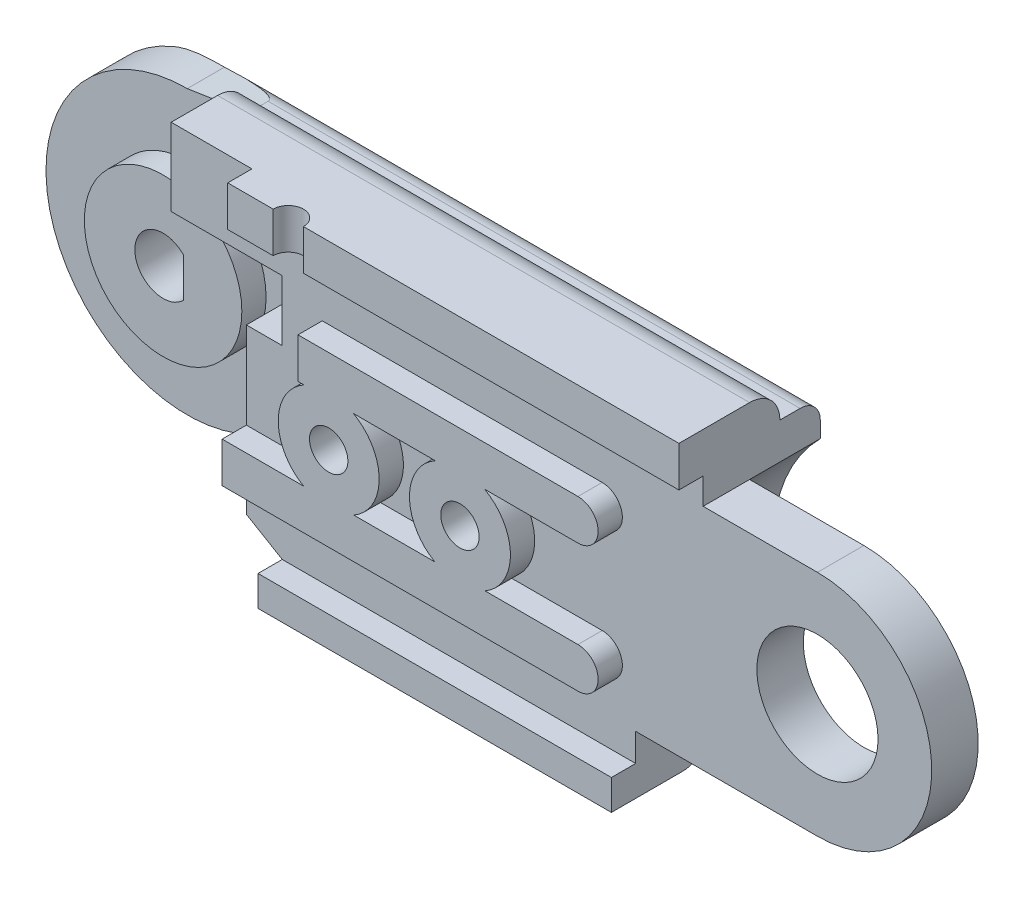
from build123d import *

# Parameters (mm, degrees)
BOSS_EXTRUDE1_DEPTH = 2
BOSS_EXTRUDE2_DEPTH = 1.5
BOSS_EXTRUDE3_DEPTH = 2.3
SKETCH6_W           = 5.48
SKETCH6_H           = 3
CUT_EXTRUDE1_DEPTH  = 3.8
SKETCH7_R           = 3
CUT_EXTRUDE2_DEPTH  = 3.3
SKETCH8_W           = 22.343145751
SKETCH8_H           = 2
SKETCH8_W_2         = 17.500252532
SKETCH8_H_2         = 1.5
BOSS_EXTRUDE4_DEPTH = 1.2
SKETCH9_R           = 2.5
BOSS_EXTRUDE5_DEPTH = 1.2
SKETCH10_R          = 0.95
CUT_EXTRUDE3_DEPTH  = 8.2
SKETCH11_R          = 2
CUT_EXTRUDE4_DEPTH  = 2.2
SKETCH12_R          = 3.9
BOSS_EXTRUDE6_DEPTH = 1.2
CUT_EXTRUDE5_DEPTH  = 3.2
FILLET1_R           = 1.5
FILLET2_R           = 1
SKETCH15_R          = 0.75
CUT_EXTRUDE6_DEPTH  = 10


with BuildPart() as part:
    # Sketch2 → Boss-Extrude1 (new body)
    with BuildSketch(Plane.XY):
        with BuildLine():
            Line((0, 7), (3, 7.456854249))
            Line((3, 7.456854249), (29.343145751, 7.456854249))
            Line((29.343145751, 7.456854249), (29.343145751, 5.656854249))
            ThreePointArc((29.343145751, 5.656854249), (27.60896374, 3.061467459), (27, 0))
            Line((27, 0), (26, -2.543145751))
            Line((26, -2.543145751), (26, -7.043145751))
            Line((26, -7.043145751), (8.499747468, -7.043145751))
            Line((8.499747468, -7.043145751), (4.949747468, -4.949747468))
            ThreePointArc((4.949747468, -4.949747468), (-6.467156728, -2.678784027), (0, 7))
        make_face()
    extrude(amount=BOSS_EXTRUDE1_DEPTH)

    # Sketch3 → Boss-Extrude2 (add)
    with BuildSketch(Plane.XY.offset(2)):
        with BuildLine():
            Line((29.343145751, 7.456854249), (29.343145751, 5.656854249))
            ThreePointArc((29.343145751, 5.656854249), (27.60896374, 3.061467459), (27, 0))
            Line((27, 0), (26, -2.543145751))
            Line((26, -2.543145751), (26, -7.043145751))
            Line((26, -7.043145751), (26, -8.543145751))
            Line((26, -8.543145751), (8.499747468, -8.543145751))
            Line((8.499747468, -8.543145751), (8.499747468, -7.043145751))
            Line((8.499747468, -7.043145751), (6.724747468, -5.996446609))
            Line((6.724747468, -5.996446609), (6.724747468, 2.126854249))
            Line((6.724747468, 2.126854249), (3, 2.126854249))
            Line((3, 2.126854249), (3, 7.456854249))
            Line((3, 7.456854249), (3, 8.956854249))
            Line((3, 8.956854249), (29.343145751, 8.956854249))
            Line((29.343145751, 8.956854249), (29.343145751, 7.456854249))
        make_face()
    extrude(amount=BOSS_EXTRUDE2_DEPTH)

    # Sketch5 → Boss-Extrude3 (add)
    with BuildSketch(Plane.XY.offset(3.5)):
        with BuildLine():
            Line((3, 7.5), (3, 2.126854249))
            Line((3, 2.126854249), (6.724747468, 2.126854249))
            Line((6.724747468, 2.126854249), (6.724747468, -5.996446609))
            Line((6.724747468, -5.996446609), (8.499747468, -7.043145751))
            Line((8.499747468, -7.043145751), (8.499747468, -8.543145751))
            Line((8.499747468, -8.543145751), (26, -8.543145751))
            Line((26, -8.543145751), (26, -5.663145751))
            Line((26, -5.663145751), (35.003145751, -5.663145751))
            ThreePointArc((35.003145751, -5.663145751), (40.663145751, -0.003145751), (35.003145751, 5.656854249))
            Line((35.003145751, 5.656854249), (29.343145751, 5.656854249))
            Line((29.343145751, 5.656854249), (29.343145751, 7.5))
            Line((29.343145751, 7.5), (29.343145751, 8.956854249))
            Line((29.343145751, 8.956854249), (3, 8.956854249))
            Line((3, 8.956854249), (3, 7.5))
        make_face()
    extrude(amount=BOSS_EXTRUDE3_DEPTH)

    # Sketch6 → Cut-Extrude1 (cut)
    with BuildSketch(Plane.XY.offset(5.8)):
        with Locations((5.74, 3.626854249)):
            Rectangle(SKETCH6_W, SKETCH6_H)
    extrude(amount=-CUT_EXTRUDE1_DEPTH, mode=Mode.SUBTRACT)

    # Sketch7 → Cut-Extrude2 (cut)
    with BuildSketch(Plane.XY.offset(5.8)):
        with Locations((35.003145751, -0.003145751)):
            Circle(SKETCH7_R)
    extrude(amount=-CUT_EXTRUDE2_DEPTH, mode=Mode.SUBTRACT)

    # Sketch8 → Boss-Extrude4 (add)
    with BuildSketch(Plane.XY.offset(5.8)):
        with Locations((18.171572876, 7.956854249)):
            Rectangle(SKETCH8_W, SKETCH8_H)
        with Locations((17.249873734, -7.793145751)):
            Rectangle(SKETCH8_W_2, SKETCH8_H_2)
        with BuildLine():
            Line((6.724747468, -4.169704782), (24.343145751, -4.169704782))
            ThreePointArc((24.343145751, -4.169704782), (25.343145751, -3.169704782), (24.343145751, -2.169704782))
            Line((24.343145751, -2.169704782), (6.724747468, -2.169704782))
            Line((6.724747468, -2.169704782), (6.724747468, -4.169704782))
        make_face()
        with BuildLine():
            Line((24.343145751, 4.180295218), (10.48, 4.180295218))
            Line((10.48, 4.180295218), (10.48, 2.180295218))
            Line((10.48, 2.180295218), (24.343145751, 2.180295218))
            ThreePointArc((24.343145751, 2.180295218), (25.343145751, 3.180295218), (24.343145751, 4.180295218))
        make_face()
    extrude(amount=BOSS_EXTRUDE4_DEPTH)

    # Sketch9 → Boss-Extrude5 (add)
    with BuildSketch(Plane.XY.offset(5.8)):
        with Locations((18.5, 0)):
            Circle(SKETCH9_R)
        with Locations((12, 0)):
            Circle(SKETCH9_R)
    extrude(amount=BOSS_EXTRUDE5_DEPTH)

    # Sketch10 → Cut-Extrude3 (cut)
    with BuildSketch(Plane.XY.offset(7)):
        with Locations((18.5, 0)):
            Circle(SKETCH10_R)
        with Locations((12, 0)):
            Circle(SKETCH10_R)
    extrude(amount=-CUT_EXTRUDE3_DEPTH, mode=Mode.SUBTRACT)

    # Sketch11 → Cut-Extrude4 (cut)
    with BuildSketch(Plane(origin=(0, 0, 0), x_dir=(-1, 0, 0), z_dir=(0, 0, -1))):
        with Locations((-12, 0)):
            Circle(SKETCH11_R)
        with Locations((-18.5, 0)):
            Circle(SKETCH11_R)
    extrude(amount=-CUT_EXTRUDE4_DEPTH, mode=Mode.SUBTRACT)

    # Sketch12 → Boss-Extrude6 (add)
    with BuildSketch(Plane.XY.offset(2)):
        Circle(SKETCH12_R)
    extrude(amount=BOSS_EXTRUDE6_DEPTH)

    # Sketch14 → Cut-Extrude5 (cut)
    with BuildSketch(Plane.XY.offset(3.2)):
        with BuildLine():
            Line((1, 0.979795897), (1, -0.979795897))
            ThreePointArc((1, -0.979795897), (-1.4, 0), (1, 0.979795897))
        make_face()
    extrude(amount=-CUT_EXTRUDE5_DEPTH, mode=Mode.SUBTRACT)

    # Fillet1
    fillet1_edges = [part.edges().sort_by_distance(p)[0] for p in [
        (16.171572875, 8.956854249, 2),
        (17.249873734, -8.543145751, 2),
    ]]
    fillet(fillet1_edges, radius=FILLET1_R - 0.0001)  # a hair under: the kernel refuses the full size

    # Fillet2
    fillet2_edges = [part.edges().sort_by_distance(p)[0] for p in [
        (17.249873734, -7.043145751, 0),
        (16.171572875, 7.456854249, 0),
    ]]
    fillet(fillet2_edges, radius=FILLET2_R)

    # Sketch15 → Cut-Extrude6 (cut)
    with BuildSketch(Plane.XZ.offset(-6.956854249)):
        with Locations((10, 7)):
            Circle(SKETCH15_R)
    extrude(amount=-CUT_EXTRUDE6_DEPTH, mode=Mode.SUBTRACT)


solid = part.part
